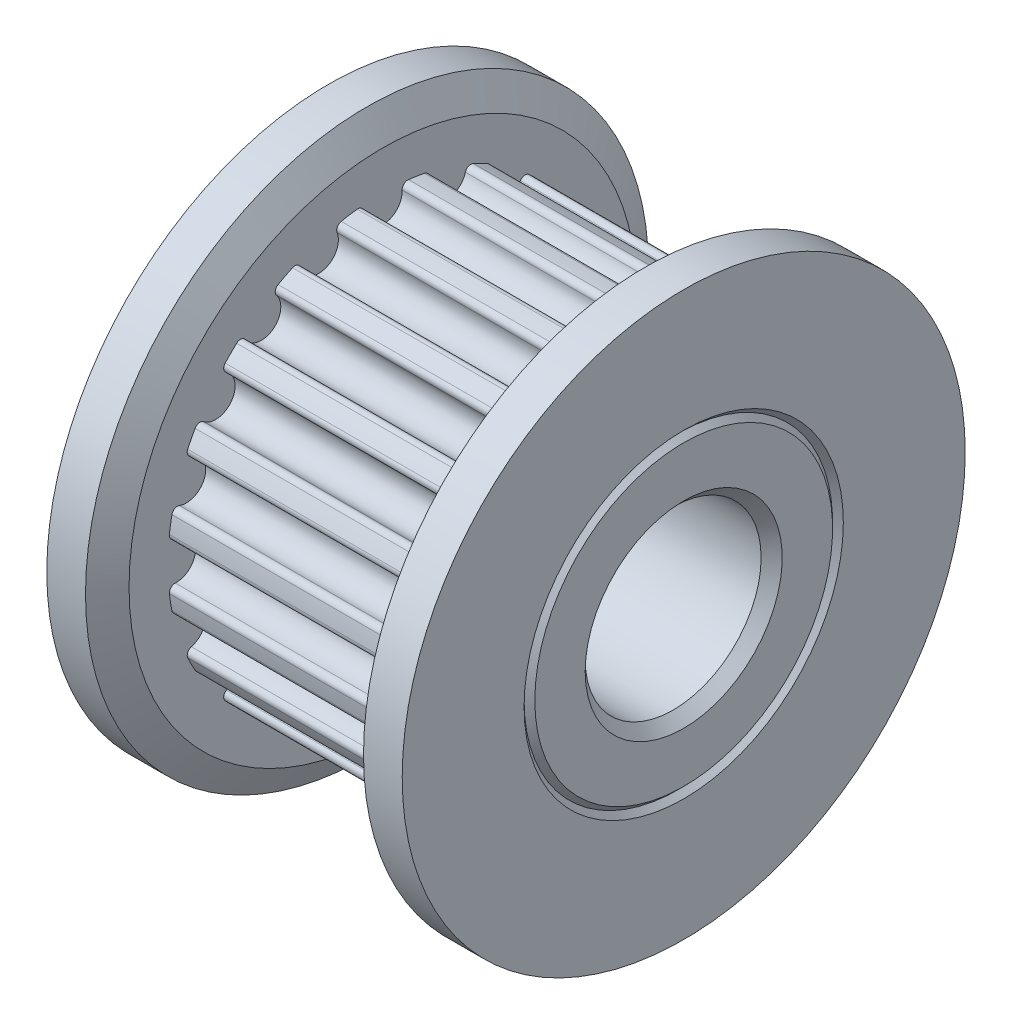
from build123d import *

# Parameters (mm, degrees)
SKETCH_2_R            = 2.5
BORE_DEPTH            = 20.595917942
SKETCH_3_R            = 0.55
CUT_EXTRUDE_20T_DEPTH = 7
FILLET_2_R            = 0.16
CHAMFER2_SIZE         = 0.3
SKETCH2_W             = 6.519588605
SKETCH2_H             = 16.134253278
CUT_EXTRUDE1_DEPTH    = 10


with BuildPart() as part:
    # Эскиз1 → Body (revolve)
    with BuildSketch(Plane.XY):
        Polygon((0, 7.213189396), (0, 0), (16, 0), (16, 4.231357606), (15.847529306, 4.383828301), (16, 4.536298995), (16, 8), (14.900291734, 8), (14.45, 7.213189396), (14.45, 6.11), (7.45, 6.11), (7.45, 7.213189396), (6.999708266, 8), (0.450291734, 8), align=None)
    revolve(axis=Axis((0, 0, 0), (1, 0, 0)))

    # Эскиз2 → Bore (cut, through all)
    with BuildSketch(Plane(origin=(16, 0, 0), x_dir=(0, 0, -1), z_dir=(1, 0, 0))):
        Circle(SKETCH_2_R)
    extrude(amount=-BORE_DEPTH, mode=Mode.SUBTRACT)

    # Эскиз3 → 20T (cut)
    with BuildSketch(Plane(origin=(7.45, 0, 0), x_dir=(0, 0, -1), z_dir=(1, 0, 0))):
        with Locations((5.582701751, -1.813929757)):
            Circle(SKETCH_3_R)
        with Locations((4.748929757, -3.450299431)):
            Circle(SKETCH_3_R)
        with Locations((3.450299431, -4.748929757)):
            Circle(SKETCH_3_R)
        with Locations((1.813929757, -5.582701751)):
            Circle(SKETCH_3_R)
        with Locations((0, -5.87)):
            Circle(SKETCH_3_R)
        with Locations((5.87, 0)):
            Circle(SKETCH_3_R)
        with Locations((-1.813929757, -5.582701751)):
            Circle(SKETCH_3_R)
        with Locations((-3.450299431, -4.748929757)):
            Circle(SKETCH_3_R)
        with Locations((-4.748929757, -3.450299431)):
            Circle(SKETCH_3_R)
        with Locations((-5.582701751, -1.813929757)):
            Circle(SKETCH_3_R)
        with Locations((-5.87, 0)):
            Circle(SKETCH_3_R)
        with Locations((-5.582701751, 1.813929757)):
            Circle(SKETCH_3_R)
        with Locations((-4.748929757, 3.450299431)):
            Circle(SKETCH_3_R)
        with Locations((-3.450299431, 4.748929757)):
            Circle(SKETCH_3_R)
        with Locations((-1.813929757, 5.582701751)):
            Circle(SKETCH_3_R)
        with Locations((0, 5.87)):
            Circle(SKETCH_3_R)
        with Locations((1.813929757, 5.582701751)):
            Circle(SKETCH_3_R)
        with Locations((3.450299431, 4.748929757)):
            Circle(SKETCH_3_R)
        with Locations((4.748929757, 3.450299431)):
            Circle(SKETCH_3_R)
        with Locations((5.582701751, 1.813929757)):
            Circle(SKETCH_3_R)
    extrude(amount=CUT_EXTRUDE_20T_DEPTH, mode=Mode.SUBTRACT)

    # Fillet 2
    fillet_2_edges = [part.edges().sort_by_distance(p)[0] for p in [
        (10.95, -0.504457922, -6.089139693),
        (10.95, 0.504457922, -6.089139693),
        (10.95, -1.401879653, -5.947002055),
        (10.95, -2.36141564, -5.635229913),
        (10.95, -3.170991479, -5.22273042),
        (10.95, -3.987221543, -4.629704566),
        (10.95, -4.629704566, -3.987221543),
        (10.95, -5.22273042, -3.170991479),
        (10.95, -5.635229913, -2.36141564),
        (10.95, -5.947002055, -1.401879653),
        (10.95, -6.089139693, -0.504457922),
        (10.95, -6.089139693, 0.504457922),
        (10.95, -5.947002055, 1.401879653),
        (10.95, -5.635229913, 2.36141564),
        (10.95, -5.22273042, 3.170991479),
        (10.95, -4.629704566, 3.987221543),
        (10.95, -3.987221543, 4.629704566),
        (10.95, -3.170991479, 5.22273042),
        (10.95, -2.36141564, 5.635229913),
        (10.95, -1.401879653, 5.947002055),
        (10.95, -0.504457922, 6.089139693),
        (10.95, 0.504457922, 6.089139693),
        (10.95, 1.401879653, 5.947002055),
        (10.95, 2.36141564, 5.635229913),
        (10.95, 3.170991479, 5.22273042),
        (10.95, 3.987221543, 4.629704566),
        (10.95, 4.629704566, 3.987221543),
        (10.95, 5.22273042, 3.170991479),
        (10.95, 5.635229913, 2.36141564),
        (10.95, 5.947002055, 1.401879653),
        (10.95, 6.089139693, -0.504457922),
        (10.95, 5.635229913, -2.36141564),
        (10.95, 4.629704566, -3.987221543),
        (10.95, 3.170991479, -5.22273042),
        (10.95, 1.401879653, -5.947002055),
        (10.95, 2.36141564, -5.635229913),
        (10.95, 3.987221543, -4.629704566),
        (10.95, 6.089139693, 0.504457922),
        (10.95, 5.947002055, -1.401879653),
        (10.95, 5.22273042, -3.170991479),
    ]]
    fillet(fillet_2_edges, radius=FILLET_2_R)

    # Chamfer2
    chamfer2_edges = [part.edges().sort_by_distance(p)[0] for p in [
        (16, 0, 2.5),
    ]]
    chamfer(chamfer2_edges, length=CHAMFER2_SIZE)

    # Sketch2 → Cut-Extrude1 (cut, symmetric)
    with BuildSketch(Plane(origin=(0, 0, 0), x_dir=(1, 0, 0), z_dir=(0, 1, 0))):
        with Locations((2.639913964, -0.067126639)):
            Rectangle(SKETCH2_W, SKETCH2_H)
    extrude(amount=CUT_EXTRUDE1_DEPTH, both=True, mode=Mode.SUBTRACT)


solid = part.part
